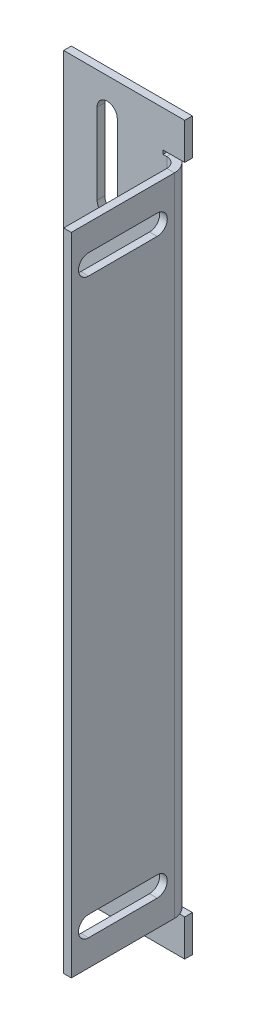
from build123d import *

# Parameters (mm, degrees)
SKETCH1_W                     = 30
SKETCH1_H                     = 180
BASE_FLANGE1_DEPTH            = 1.89738
EDGE_FLANGE1_STRIP_W          = 12.66952
EDGE_FLANGE1_STRIP_H          = 1.89738
EDGE_FLANGE1_STRIP_CUT_DEPTH  = 160
EDGE_FLANGE1_RELIEF_W         = 13.61821
EDGE_FLANGE1_RELIEF_H         = 0.94869
EDGE_FLANGE1_RELIEF_CUT_DEPTH = 1.89738
EDGE_FLANGE1_DEPTH            = 160
CUT_EXTRUDE1_DEPTH            = 10
CUT_EXTRUDE2_DEPTH            = 10


# Sheet-metal steps are written as plain solids
with BuildPart() as part:
    # Sketch1 → Base-Flange1 (new body)
    with BuildSketch(Plane.XY):
        with Locations((-15, -23.144555198)):
            Rectangle(SKETCH1_W, SKETCH1_H)
    extrude(amount=-BASE_FLANGE1_DEPTH)

    # Edge-Flange1 strip (across the edge) → Edge-Flange1 strip cut (cut)
    with BuildSketch(Plane(origin=(0, -103.144555198, 0), x_dir=(-1, 0, 0), z_dir=(0, 1, 0))):
        with Locations((-1.89738, -0.94869)):
            Rectangle(EDGE_FLANGE1_STRIP_W, EDGE_FLANGE1_STRIP_H)
    extrude(amount=EDGE_FLANGE1_STRIP_CUT_DEPTH, mode=Mode.SUBTRACT)

    # Edge-Flange1 relief (on the sheet) → Edge-Flange1 relief cut (cut)
    with BuildSketch(Plane(origin=(-4.43738, -103.144555198, 0), x_dir=(-1, 0, 0), z_dir=(0, 0, 1))):
        with Locations((-5.860415, 0.474345)):
            Rectangle(EDGE_FLANGE1_RELIEF_W, EDGE_FLANGE1_RELIEF_H)
        with Locations((-5.860415, -160.474345)):
            Rectangle(EDGE_FLANGE1_RELIEF_W, EDGE_FLANGE1_RELIEF_H)
    extrude(amount=-EDGE_FLANGE1_RELIEF_CUT_DEPTH, mode=Mode.SUBTRACT)

    # Edge-Flange1 section (across the edge) → Edge-Flange1 (add)
    with BuildSketch(Plane(origin=(0, -103.144555198, 0), x_dir=(-1, 0, 0), z_dir=(0, 1, 0))):
        with BuildLine():
            Line((0, 2.54), (0, 28.10262))
            Line((0, 28.10262), (1.89738, 28.10262))
            Line((1.89738, 28.10262), (1.89738, 2.54))
            ThreePointArc((1.89738, 2.54), (2.641328776, 0.743948776), (4.43738, 0))
            Line((4.43738, 0), (4.43738, -1.89738))
            ThreePointArc((4.43738, -1.89738), (1.299678511, -0.597701489), (0, 2.54))
        make_face()
    extrude(amount=EDGE_FLANGE1_DEPTH)

    # Sketch9 → Cut-Extrude1 (cut)
    with BuildSketch(Plane.ZY.offset(1.89738)):
        with BuildLine():
            Line((23.82131, 45.355444802), (6.82131, 45.355444802))
            ThreePointArc((6.82131, 45.355444802), (4.32131, 47.855444802), (6.82131, 50.355444802))
            Line((6.82131, 50.355444802), (23.82131, 50.355444802))
            ThreePointArc((23.82131, 50.355444802), (26.32131, 47.855444802), (23.82131, 45.355444802))
        make_face()
        with BuildLine():
            Line((6.82131, -91.644555198), (23.82131, -91.644555198))
            ThreePointArc((23.82131, -91.644555198), (26.32131, -94.144555198), (23.82131, -96.644555198))
            Line((23.82131, -96.644555198), (6.82131, -96.644555198))
            ThreePointArc((6.82131, -96.644555198), (4.32131, -94.144555198), (6.82131, -91.644555198))
        make_face()
    extrude(amount=-CUT_EXTRUDE1_DEPTH, mode=Mode.SUBTRACT)

    # Sketch11 → Cut-Extrude2 (cut)
    with BuildSketch(Plane(origin=(0, 0, -1.89738), x_dir=(-1, 0, 0), z_dir=(0, 0, -1))):
        with BuildLine():
            Line((16.708962543, -105.144555198), (16.708962543, -85.144555198))
            ThreePointArc((16.708962543, -85.144555198), (19.208962543, -82.644555198), (21.708962543, -85.144555198))
            Line((21.708962543, -85.144555198), (21.708962543, -105.144555198))
            ThreePointArc((21.708962543, -105.144555198), (19.208962543, -107.644555198), (16.708962543, -105.144555198))
        make_face()
        with BuildLine():
            Line((16.708962543, 38.855444802), (16.708962543, 58.855444802))
            ThreePointArc((16.708962543, 58.855444802), (19.208962543, 61.355444802), (21.708962543, 58.855444802))
            Line((21.708962543, 58.855444802), (21.708962543, 38.855444802))
            ThreePointArc((21.708962543, 38.855444802), (19.208962543, 36.355444802), (16.708962543, 38.855444802))
        make_face()
    extrude(amount=-CUT_EXTRUDE2_DEPTH, mode=Mode.SUBTRACT)


solid = part.part
